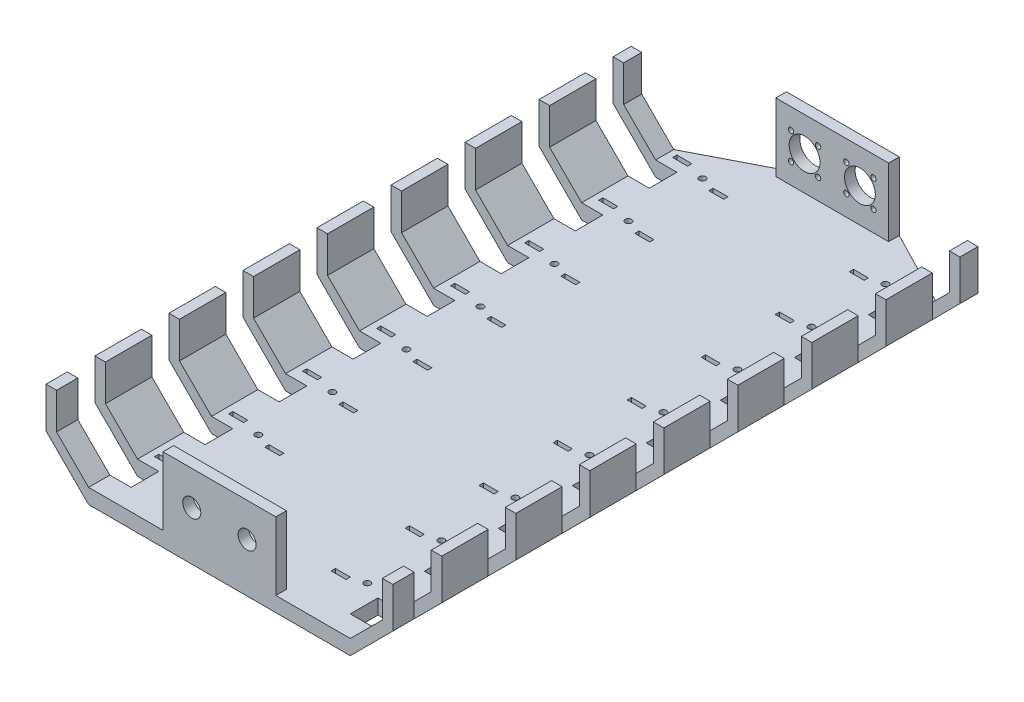
from build123d import *

# Parameters (mm, degrees)
BOSS_EXTRUDE1_DEPTH      = 7
SKETCH2_W                = 123
SKETCH2_H                = 5
BOSS_EXTRUDE2_DEPTH      = 32
SKETCH9_W                = 123
SKETCH9_H                = 7
BOSS_EXTRUDE4_DEPTH      = 5
SKETCH13_W               = 35
SKETCH13_H               = 32
CUT_EXTRUDE5_DEPTH       = 11
BOSS_EXTRUDE10_DEPTH     = 275
BOSS_EXTRUDE13_DEPTH     = 7
SKETCH18_W               = 53
SKETCH18_H               = 5
BOSS_EXTRUDE14_DEPTH     = 32
SKETCH3_R                = 4.25
CUT_EXTRUDE8_DEPTH       = 334
SKETCH19_R               = 7.25
SKETCH19_R_2             = 1.25
CUT_EXTRUDE9_DEPTH       = 334
CUT_EXTRUDE13_DEPTH      = 19
CUT_EXTRUDE16_DEPTH      = 181.638451056
CUT_EXTRUDE16_DEPTH_BACK = 181.638451056
SKETCH32_R               = 1.5
SKETCH32_W               = 30
SKETCH32_H               = 13
SKETCH32_W_2             = 7
SKETCH32_H_2             = 2


with BuildPart() as part:
    # Sketch1 → Boss-Extrude1 (new body)
    with BuildSketch(Plane(origin=(0, 0, 0), x_dir=(1, 0, 0), z_dir=(0, 1, 0))):
        Polygon((-13, 135), (-36, 135), (-61.5, 135), (-61.5, -135), (-36, -135), (-13, -135), (13, -135), (36, -135), (61.5, -135), (61.5, 135), (36, 135), (13, 135), align=None)
    extrude(amount=BOSS_EXTRUDE1_DEPTH)

    # Sketch2 → Boss-Extrude2 (add)
    with BuildSketch(Plane(origin=(0, 7, 0), x_dir=(1, 0, 0), z_dir=(0, 1, 0))):
        with Locations((0, -132.5)):
            Rectangle(SKETCH2_W, SKETCH2_H)
    extrude(amount=BOSS_EXTRUDE2_DEPTH)

    # Sketch9 → Boss-Extrude4 (add)
    with BuildSketch(Plane(origin=(0, 0, -135), x_dir=(-1, 0, 0), z_dir=(0, 0, -1))):
        with Locations((0, 3.5)):
            Rectangle(SKETCH9_W, SKETCH9_H)
    extrude(amount=BOSS_EXTRUDE4_DEPTH)

    # Sketch13 → Cut-Extrude5 (cut)
    with BuildSketch(Plane.XY.offset(135)):
        with Locations((-44, 23)):
            Rectangle(SKETCH13_W, SKETCH13_H)
        with Locations((44, 23)):
            Rectangle(SKETCH13_W, SKETCH13_H)
    extrude(amount=-CUT_EXTRUDE5_DEPTH, mode=Mode.SUBTRACT)

    # Sketch14 → Boss-Extrude10 (add)
    with BuildSketch(Plane.XY.offset(135)):
        Polygon((-61.5, 0), (-81.5, 20), (-81.5, 39), (-76.55, 39), (-76.55, 22.05), (-61.5, 7), align=None)
        Polygon((76.55, 39), (76.55, 22.05), (61.5, 7), (61.5, 0), (81.5, 20), (81.5, 39), align=None)
    extrude(amount=-BOSS_EXTRUDE10_DEPTH)

    # Sketch17 → Boss-Extrude13 (add)
    with BuildSketch(Plane(origin=(0, 7, 0), x_dir=(1, 0, 0), z_dir=(0, 1, 0))):
        Polygon((-61.5, 140), (-26.5, 226), (0, 226), (26.5, 226), (61.5, 140), align=None)
    extrude(amount=-BOSS_EXTRUDE13_DEPTH)

    # Sketch18 → Boss-Extrude14 (add)
    with BuildSketch(Plane(origin=(0, 7, 0), x_dir=(1, 0, 0), z_dir=(0, 1, 0))):
        with Locations((0, 155.5)):
            Rectangle(SKETCH18_W, SKETCH18_H)
    extrude(amount=BOSS_EXTRUDE14_DEPTH)

    # Sketch3 → Cut-Extrude8 (cut)
    with BuildSketch(Plane.XY.offset(135)):
        with Locations((-13, 23)):
            Circle(SKETCH3_R)
        with Locations((13, 23)):
            Circle(SKETCH3_R)
    extrude(amount=-CUT_EXTRUDE8_DEPTH, mode=Mode.SUBTRACT)

    # Sketch19 → Cut-Extrude9 (cut)
    with BuildSketch(Plane.XY.offset(-153)):
        with Locations((-13, 23)):
            Circle(SKETCH19_R)
        with Locations((-6.636038969, 16.636038969)):
            Circle(SKETCH19_R_2)
        with Locations((-6.636038969, 29.363961031)):
            Circle(SKETCH19_R_2)
        with Locations((-19.363961031, 29.363961031)):
            Circle(SKETCH19_R_2)
        with Locations((-19.363961031, 16.636038969)):
            Circle(SKETCH19_R_2)
        with Locations((13, 23)):
            Circle(SKETCH19_R)
        with Locations((19.363961031, 16.636038969)):
            Circle(SKETCH19_R_2)
        with Locations((6.636038969, 16.636038969)):
            Circle(SKETCH19_R_2)
        with Locations((6.636038969, 29.363961031)):
            Circle(SKETCH19_R_2)
        with Locations((19.363961031, 29.363961031)):
            Circle(SKETCH19_R_2)
    extrude(amount=-CUT_EXTRUDE9_DEPTH, mode=Mode.SUBTRACT)

    # Sketch29 → Cut-Extrude13 (cut)
    with BuildSketch(Plane(origin=(0, 7, 0), x_dir=(1, 0, 0), z_dir=(0, 1, 0))):
        Polygon((-61.5, 140), (-26.5, 158), (26.5, 158), (61.5, 140), (26.5, 226), (-26.5, 226), align=None)
    extrude(amount=-CUT_EXTRUDE13_DEPTH, mode=Mode.SUBTRACT)

    # Sketch32 → Cut-Extrude16 (cut, two sides: drawn at the far end of the back side and taken through both)
    with BuildSketch(Plane(origin=(0, 7, 0), x_dir=(1, 0, 0), z_dir=(0, 1, 0)).offset(-CUT_EXTRUDE16_DEPTH_BACK)):
        with Locations((-43, 135)):
            Circle(SKETCH32_R)
        with Locations((-43, 100.214285714)):
            Circle(SKETCH32_R)
        with Locations((-43, 65.428571429)):
            Circle(SKETCH32_R)
        with Locations((-43, 30.642857143)):
            Circle(SKETCH32_R)
        with Locations((-43, -4.142857143)):
            Circle(SKETCH32_R)
        with Locations((-43, -38.928571429)):
            Circle(SKETCH32_R)
        with Locations((-43, -73.714285714)):
            Circle(SKETCH32_R)
        with Locations((-43, -108.5)):
            Circle(SKETCH32_R)
        with Locations((43, -108.5)):
            Circle(SKETCH32_R)
        with Locations((43, -73.714285714)):
            Circle(SKETCH32_R)
        with Locations((43, -38.928571429)):
            Circle(SKETCH32_R)
        with Locations((43, -4.142857143)):
            Circle(SKETCH32_R)
        with Locations((43, 30.642857143)):
            Circle(SKETCH32_R)
        with Locations((43, 65.428571429)):
            Circle(SKETCH32_R)
        with Locations((43, 100.214285714)):
            Circle(SKETCH32_R)
        with Locations((43, 135)):
            Circle(SKETCH32_R)
        with Locations((-66.5, 125)):
            Rectangle(SKETCH32_W, SKETCH32_H)
        with Locations((-55, 137.5)):
            Rectangle(SKETCH32_W_2, SKETCH32_H_2)
        with Locations((-33, 132.5)):
            Rectangle(SKETCH32_W_2, SKETCH32_H_2)
        with Locations((-66.5, 90.214285714)):
            Rectangle(SKETCH32_W, SKETCH32_H)
        with Locations((-55, 102.714285714)):
            Rectangle(SKETCH32_W_2, SKETCH32_H_2)
        with Locations((-33, 97.714285714)):
            Rectangle(SKETCH32_W_2, SKETCH32_H_2)
        with Locations((-66.5, 55.428571429)):
            Rectangle(SKETCH32_W, SKETCH32_H)
        with Locations((-55, 67.928571429)):
            Rectangle(SKETCH32_W_2, SKETCH32_H_2)
        with Locations((-33, 62.928571429)):
            Rectangle(SKETCH32_W_2, SKETCH32_H_2)
        with Locations((-66.5, 20.642857143)):
            Rectangle(SKETCH32_W, SKETCH32_H)
        with Locations((-55, 33.142857143)):
            Rectangle(SKETCH32_W_2, SKETCH32_H_2)
        with Locations((-33, 28.142857143)):
            Rectangle(SKETCH32_W_2, SKETCH32_H_2)
        with Locations((-66.5, -14.142857143)):
            Rectangle(SKETCH32_W, SKETCH32_H)
        with Locations((-55, -1.642857143)):
            Rectangle(SKETCH32_W_2, SKETCH32_H_2)
        with Locations((-33, -6.642857143)):
            Rectangle(SKETCH32_W_2, SKETCH32_H_2)
        with Locations((-66.5, -48.928571429)):
            Rectangle(SKETCH32_W, SKETCH32_H)
        with Locations((-55, -36.428571429)):
            Rectangle(SKETCH32_W_2, SKETCH32_H_2)
        with Locations((-33, -41.428571429)):
            Rectangle(SKETCH32_W_2, SKETCH32_H_2)
        with Locations((-66.5, -83.714285714)):
            Rectangle(SKETCH32_W, SKETCH32_H)
        with Locations((-55, -71.214285714)):
            Rectangle(SKETCH32_W_2, SKETCH32_H_2)
        with Locations((-33, -76.214285714)):
            Rectangle(SKETCH32_W_2, SKETCH32_H_2)
        with Locations((-66.5, -118.5)):
            Rectangle(SKETCH32_W, SKETCH32_H)
        with Locations((-55, -106)):
            Rectangle(SKETCH32_W_2, SKETCH32_H_2)
        with Locations((-33, -111)):
            Rectangle(SKETCH32_W_2, SKETCH32_H_2)
        with Locations((33, -111)):
            Rectangle(SKETCH32_W_2, SKETCH32_H_2)
        with Locations((55, -106)):
            Rectangle(SKETCH32_W_2, SKETCH32_H_2)
        with Locations((66.5, -118.5)):
            Rectangle(SKETCH32_W, SKETCH32_H)
        with Locations((33, -76.214285714)):
            Rectangle(SKETCH32_W_2, SKETCH32_H_2)
        with Locations((55, -71.214285714)):
            Rectangle(SKETCH32_W_2, SKETCH32_H_2)
        with Locations((66.5, -83.714285714)):
            Rectangle(SKETCH32_W, SKETCH32_H)
        with Locations((33, -41.428571429)):
            Rectangle(SKETCH32_W_2, SKETCH32_H_2)
        with Locations((55, -36.428571429)):
            Rectangle(SKETCH32_W_2, SKETCH32_H_2)
        with Locations((66.5, -48.928571429)):
            Rectangle(SKETCH32_W, SKETCH32_H)
        with Locations((33, -6.642857143)):
            Rectangle(SKETCH32_W_2, SKETCH32_H_2)
        with Locations((55, -1.642857143)):
            Rectangle(SKETCH32_W_2, SKETCH32_H_2)
        with Locations((66.5, -14.142857143)):
            Rectangle(SKETCH32_W, SKETCH32_H)
        with Locations((33, 28.142857143)):
            Rectangle(SKETCH32_W_2, SKETCH32_H_2)
        with Locations((55, 33.142857143)):
            Rectangle(SKETCH32_W_2, SKETCH32_H_2)
        with Locations((66.5, 20.642857143)):
            Rectangle(SKETCH32_W, SKETCH32_H)
        with Locations((33, 62.928571429)):
            Rectangle(SKETCH32_W_2, SKETCH32_H_2)
        with Locations((55, 67.928571429)):
            Rectangle(SKETCH32_W_2, SKETCH32_H_2)
        with Locations((66.5, 55.428571429)):
            Rectangle(SKETCH32_W, SKETCH32_H)
        with Locations((33, 97.714285714)):
            Rectangle(SKETCH32_W_2, SKETCH32_H_2)
        with Locations((55, 102.714285714)):
            Rectangle(SKETCH32_W_2, SKETCH32_H_2)
        with Locations((66.5, 90.214285714)):
            Rectangle(SKETCH32_W, SKETCH32_H)
        with Locations((66.5, 125)):
            Rectangle(SKETCH32_W, SKETCH32_H)
        with Locations((33, 132.5)):
            Rectangle(SKETCH32_W_2, SKETCH32_H_2)
        with Locations((55, 137.5)):
            Rectangle(SKETCH32_W_2, SKETCH32_H_2)
    extrude(amount=CUT_EXTRUDE16_DEPTH + CUT_EXTRUDE16_DEPTH_BACK, mode=Mode.SUBTRACT)


solid = part.part
